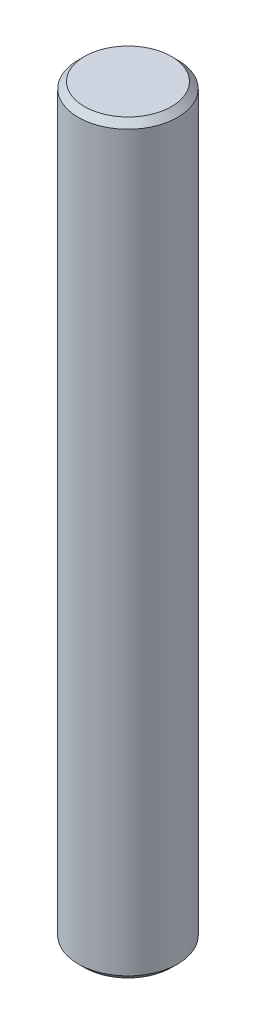
from build123d import *

# Parameters (mm, degrees)
SKETCH1_R           = 2
BOSS_EXTRUDE1_DEPTH = 15
CHAMFER1_SIZE       = 0.25


with BuildPart() as part:
    # Sketch1 → Boss-Extrude1 (new, symmetric)
    with BuildSketch(Plane(origin=(0, 0, 0), x_dir=(1, 0, 0), z_dir=(0, 1, 0))):
        Circle(SKETCH1_R)
    extrude(amount=BOSS_EXTRUDE1_DEPTH, both=True)

    # Chamfer1
    chamfer1_edges = [part.edges().sort_by_distance(p)[0] for p in [
        (-2, -15, 0),
        (-2, 15, 0),
    ]]
    chamfer(chamfer1_edges, length=CHAMFER1_SIZE)


solid = part.part
